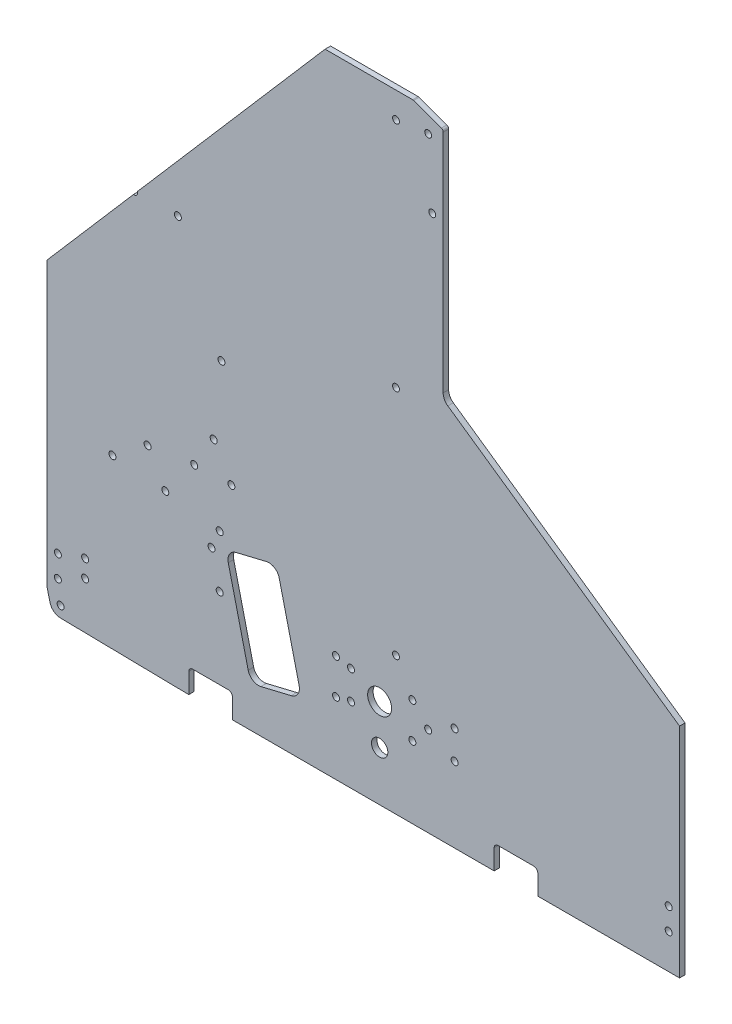
from build123d import *

# Parameters (mm, degrees)
SKETCH1_R           = 2.032
SKETCH1_R_2         = 2
BOSS_EXTRUDE1_DEPTH = 3.175
FILLET1_R           = 2.286
FILLET2_R           = 6.35
SKETCH2_R           = 2.032
CUT_EXTRUDE1_DEPTH  = 505.524983177
FILLET3_R           = 1.5875
CUT_EXTRUDE2_DEPTH  = 505.524983177
SKETCH4_R           = 2.032
SKETCH4_R_2         = 6.985
SKETCH4_R_3         = 4.7625
CUT_EXTRUDE3_DEPTH  = 505.524983177


with BuildPart() as part:
    # Sketch1 → Boss-Extrude1 (new body)
    with BuildSketch(Plane.XY):
        with BuildLine():
            Line((7.829508682, -19.049081656), (82.55, -20.32))
            Line((82.55, -20.32), (82.55, -6.35))
            Line((82.55, -6.35), (107.95, -6.35))
            Line((107.95, -6.35), (107.95, -20.32))
            Line((107.95, -20.32), (260.35, -20.32))
            Line((260.35, -20.32), (260.35, -6.35))
            Line((260.35, -6.35), (285.75, -6.35))
            Line((285.75, -6.35), (285.75, -20.32))
            Line((285.75, -20.32), (368.3, -20.32))
            Line((368.3, -20.32), (368.3, 106.68))
            Line((368.3, 106.68), (230.66375, 202.565))
            Line((230.66375, 202.565), (230.66375, 338.455))
            Line((230.66375, 338.455), (213.19998, 344.805))
            Line((213.19998, 344.805), (203.2, 344.805))
            Line((203.2, 344.805), (161.925, 344.805))
            Line((161.925, 344.805), (52.720122664, 218.469945827))
            ThreePointArc((52.720122664, 218.469945827), (52.803835479, 218.142145922), (52.832, 217.805))
            ThreePointArc((52.832, 217.805), (52.095493096, 216.239521914), (50.419872403, 215.808871996))
            Line((50.419872403, 215.808871996), (0, 157.48))
            Line((0, 157.48), (0, 0))
            Line((0, 0), (0, -6.35))
            ThreePointArc((0, -6.35), (0.047577015, -7.125863724), (0.189595124, -7.890101219))
            Line((0.189595124, -7.890101219), (1.777095124, -14.240101219))
            ThreePointArc((1.777095124, -14.240101219), (3.987212552, -17.671692778), (7.829508682, -19.049081656))
        make_face()
        with Locations((7.9375, -12.7)):
            Circle(SKETCH1_R, mode=Mode.SUBTRACT)
        with Locations((6.35, 0)):
            Circle(SKETCH1_R, mode=Mode.SUBTRACT)
        with Locations((6.35, 12.7)):
            Circle(SKETCH1_R, mode=Mode.SUBTRACT)
        with Locations((95.797306087, 60.410494967)):
            Circle(SKETCH1_R, mode=Mode.SUBTRACT)
        with Locations((38.1, 78.105)):
            Circle(SKETCH1_R, mode=Mode.SUBTRACT)
        with Locations((68.887329744, 75.518700365)):
            Circle(SKETCH1_R, mode=Mode.SUBTRACT)
        with Locations((58.568579744, 93.391299635)):
            Circle(SKETCH1_R, mode=Mode.SUBTRACT)
        with Locations((85.725, 97.155)):
            Circle(SKETCH1_R, mode=Mode.SUBTRACT)
        with Locations((107.382158942, 97.743700365)):
            Circle(SKETCH1_R, mode=Mode.SUBTRACT)
        with Locations((97.063408942, 115.616299635)):
            Circle(SKETCH1_R, mode=Mode.SUBTRACT)
        with Locations((101.6, 157.48)):
            Circle(SKETCH1_R, mode=Mode.SUBTRACT)
        with Locations((203.2, 59.805)):
            Circle(SKETCH1_R_2, mode=Mode.SUBTRACT)
        with Locations((361.95, 0)):
            Circle(SKETCH1_R, mode=Mode.SUBTRACT)
        with Locations((361.95, 12.7)):
            Circle(SKETCH1_R, mode=Mode.SUBTRACT)
        with Locations((76.2, 217.805)):
            Circle(SKETCH1_R, mode=Mode.SUBTRACT)
        with Locations((203.2, 194.805)):
            Circle(SKETCH1_R_2, mode=Mode.SUBTRACT)
        with Locations((224.31375, 293.243)):
            Circle(SKETCH1_R, mode=Mode.SUBTRACT)
        with Locations((203.2, 329.805)):
            Circle(SKETCH1_R_2, mode=Mode.SUBTRACT)
        with Locations((221.931865, 332.105)):
            Circle(SKETCH1_R_2, mode=Mode.SUBTRACT)
    extrude(amount=BOSS_EXTRUDE1_DEPTH)

    # Fillet1
    fillet1_edges = [part.edges().sort_by_distance(p)[0] for p in [
        (285.75, -6.35, 1.5875),
        (107.95, -6.35, 1.5875),
        (260.35, -6.35, 1.5875),
        (82.55, -6.35, 1.5875),
    ]]
    fillet(fillet1_edges, radius=FILLET1_R)

    # Fillet2
    fillet2_edges = [part.edges().sort_by_distance(p)[0] for p in [
        (230.66375, 202.565, 1.5875),
    ]]
    fillet(fillet2_edges, radius=FILLET2_R)

    # Sketch2 → Cut-Extrude1 (cut, through all)
    with BuildSketch(Plane(origin=(0, 0, 0), x_dir=(-1, 0, 0), z_dir=(0, 0, -1))):
        with Locations((-100.552770272, 71.086035298)):
            Circle(SKETCH2_R)
        with Locations((-100.552770272, 40.606035298)):
            Circle(SKETCH2_R)
        with Locations((-22.225, 18.202541089)):
            Circle(SKETCH2_R)
        with Locations((-22.225, 8.042541089)):
            Circle(SKETCH2_R)
    extrude(amount=-CUT_EXTRUDE1_DEPTH, mode=Mode.SUBTRACT)

    # Fillet3
    fillet3_edges = [part.edges().sort_by_distance(p)[0] for p in [
        (230.66375, 338.455, 1.5875),
        (213.19998, 344.805, 1.5875),
    ]]
    fillet(fillet3_edges, radius=FILLET3_R)

    # Sketch3 → Cut-Extrude2 (cut, through all)
    with BuildSketch(Plane.XY.offset(3.175)):
        with BuildLine():
            Line((127.789350211, 69.359774106), (110.090750339, 65.117184968))
            ThreePointArc((110.090750339, 65.117184968), (106.287939856, 62.356288953), (105.55119507, 57.715047577))
            Line((105.55119507, 57.715047577), (117.160037875, 9.287010566))
            ThreePointArc((117.160037875, 9.287010566), (119.92093389, 5.484200083), (124.562175266, 4.747455297))
            Line((124.562175266, 4.747455297), (142.260775137, 8.990044434))
            ThreePointArc((142.260775137, 8.990044434), (146.063585621, 11.75094045), (146.800330407, 16.392181825))
            Line((146.800330407, 16.392181825), (135.191487602, 64.820218836))
            ThreePointArc((135.191487602, 64.820218836), (132.430591586, 68.62302932), (127.789350211, 69.359774106))
        make_face()
    extrude(amount=-CUT_EXTRUDE2_DEPTH, mode=Mode.SUBTRACT)

    # Sketch4 → Cut-Extrude3 (cut, through all)
    with BuildSketch(Plane.XY.offset(3.175)):
        with Locations((168.275, 42.06875)):
            Circle(SKETCH4_R)
        with Locations((212.725, 42.06875)):
            Circle(SKETCH4_R)
        with Locations((212.725, 21.43125)):
            Circle(SKETCH4_R)
        with Locations((168.275, 21.43125)):
            Circle(SKETCH4_R)
        with Locations((193.675, 31.75)):
            Circle(SKETCH4_R_2)
        with Locations((177.00498, 40.0431)):
            Circle(SKETCH4_R)
        with Locations((177.00498, 23.4569)):
            Circle(SKETCH4_R)
        with Locations((237.32998, 40.0431)):
            Circle(SKETCH4_R)
        with Locations((237.32998, 23.4569)):
            Circle(SKETCH4_R)
        with Locations((193.675, 8.466666658)):
            Circle(SKETCH4_R_3)
        with Locations((221.931865, 31.75)):
            Circle(SKETCH4_R)
    extrude(amount=-CUT_EXTRUDE3_DEPTH, mode=Mode.SUBTRACT)


solid = part.part
